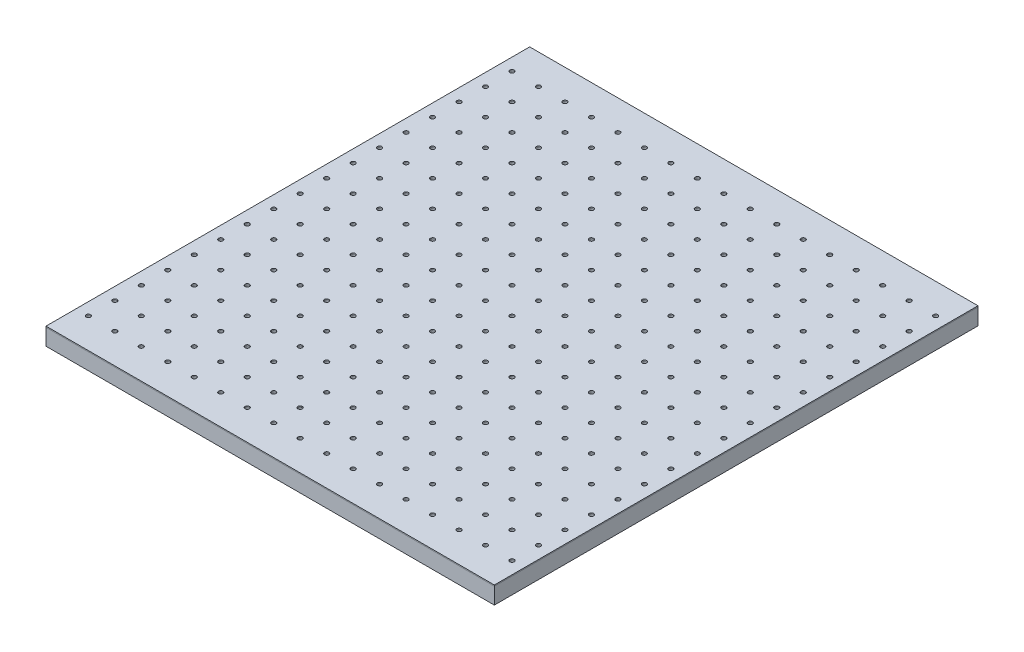
from build123d import *

# Parameters (mm, degrees)
SKETCH1_W            = 508
SKETCH1_H            = 548
BOSS_EXTRUDE1_DEPTH  = 18.5
BOSS_EXTRUDE2_START  = 18.5
SKETCH1_3_W          = 508
SKETCH1_3_H          = 548
BOSS_EXTRUDE2_DEPTH  = 1.27
SKETCH1_10_R         = 2.5
CUT_EXTRUDE3_DEPTH   = 19.77
LPATTERN1_COUNT      = 9
LPATTERN1_PITCH      = 30
LPATTERN1_COUNT_DIR2 = 9
LPATTERN1_PITCH_DIR2 = 30
MIRROR1_START        = 18
MIRROR1_OUTLINE_R    = 2.5
MIRROR1_DEPTH        = 3
MIRROR1_START_2      = -1
MIRROR1_2_OUTLINE_R  = 2.5
MIRROR1_2_DEPTH      = 20
MIRROR2_START        = 18
MIRROR2_OUTLINE_R    = 2.5
MIRROR2_DEPTH        = 3
MIRROR2_START_2      = -1
MIRROR2_2_OUTLINE_R  = 2.5
MIRROR2_2_DEPTH      = 20


with BuildPart() as part:
    # Sketch1 → Boss-Extrude1 (new body)
    with BuildSketch(Plane(origin=(0, 0, 0), x_dir=(1, 0, 0), z_dir=(0, 1, 0))):
        with Locations((-23.980732177, 60.620423892)):
            Rectangle(SKETCH1_W, SKETCH1_H)
    extrude(amount=BOSS_EXTRUDE1_DEPTH)


with BuildPart() as body_2:
    # Sketch1<3> → Boss-Extrude2 (new body)
    with BuildSketch(Plane(origin=(0, 0, 0), x_dir=(1, 0, 0), z_dir=(0, 1, 0)).offset(BOSS_EXTRUDE2_START)):
        with Locations((-23.980732177, 60.620423892)):
            Rectangle(SKETCH1_3_W, SKETCH1_3_H)
    extrude(amount=BOSS_EXTRUDE2_DEPTH)


with BuildPart() as cut_extrude3_tool:
    # Sketch1<10> → Cut-Extrude3 (new body)
    with BuildSketch(Plane(origin=(0, 0, 0), x_dir=(1, 0, 0), z_dir=(0, 1, 0))):
        with Locations(Location((-23.980732177, 60.620423892, 0), (0, 0, 90))):
            Circle(SKETCH1_10_R)
    cut_extrude3 = extrude(amount=CUT_EXTRUDE3_DEPTH)


with BuildPart() as part_1:
    add(part.part)

    # Cut-Extrude3: cut by cut_extrude3_tool
    add(cut_extrude3_tool.part, mode=Mode.SUBTRACT)


with BuildPart() as body_2_1:
    add(body_2.part)

    # Cut-Extrude3: cut by cut_extrude3_tool
    add(cut_extrude3_tool.part, mode=Mode.SUBTRACT)


with BuildPart() as lpattern1_tool:
    # LPattern1: Cut-Extrude3 9 × 9
    with Locations(*[(-i * LPATTERN1_PITCH, 0, j * LPATTERN1_PITCH_DIR2) for i in range(LPATTERN1_COUNT) for j in range(LPATTERN1_COUNT_DIR2) if (i, j) != (0, 0)]):
        add(cut_extrude3)


with BuildPart() as part_2:
    add(part_1.part)

    # LPattern1: cut by lpattern1_tool
    add(lpattern1_tool.part, mode=Mode.SUBTRACT)

    # Mirror1 2 outline → Mirror1 2 (cut)
    with BuildSketch(Plane(origin=(0, 0, 0), x_dir=(1, 0, 0), z_dir=(0, 1, 0)).offset(MIRROR1_START_2)):
        with Locations((216.019267823, -179.379576108)):
            Circle(MIRROR1_2_OUTLINE_R)
        with Locations((6.019267823, 60.620423892)):
            Circle(MIRROR1_2_OUTLINE_R)
        with Locations((6.019267823, 30.620423892)):
            Circle(MIRROR1_2_OUTLINE_R)
        with Locations((6.019267823, 0.620423892)):
            Circle(MIRROR1_2_OUTLINE_R)
        with Locations((6.019267823, -29.379576108)):
            Circle(MIRROR1_2_OUTLINE_R)
        with Locations((6.019267823, -59.379576108)):
            Circle(MIRROR1_2_OUTLINE_R)
        with Locations((6.019267823, -89.379576108)):
            Circle(MIRROR1_2_OUTLINE_R)
        with Locations((6.019267823, -119.379576108)):
            Circle(MIRROR1_2_OUTLINE_R)
        with Locations((6.019267823, -149.379576108)):
            Circle(MIRROR1_2_OUTLINE_R)
        with Locations((6.019267823, -179.379576108)):
            Circle(MIRROR1_2_OUTLINE_R)
        with Locations((36.019267823, 60.620423892)):
            Circle(MIRROR1_2_OUTLINE_R)
        with Locations((36.019267823, 30.620423892)):
            Circle(MIRROR1_2_OUTLINE_R)
        with Locations((36.019267823, 0.620423892)):
            Circle(MIRROR1_2_OUTLINE_R)
        with Locations((36.019267823, -29.379576108)):
            Circle(MIRROR1_2_OUTLINE_R)
        with Locations((36.019267823, -59.379576108)):
            Circle(MIRROR1_2_OUTLINE_R)
        with Locations((36.019267823, -89.379576108)):
            Circle(MIRROR1_2_OUTLINE_R)
        with Locations((36.019267823, -119.379576108)):
            Circle(MIRROR1_2_OUTLINE_R)
        with Locations((36.019267823, -149.379576108)):
            Circle(MIRROR1_2_OUTLINE_R)
        with Locations((36.019267823, -179.379576108)):
            Circle(MIRROR1_2_OUTLINE_R)
        with Locations((66.019267823, 60.620423892)):
            Circle(MIRROR1_2_OUTLINE_R)
        with Locations((66.019267823, 30.620423892)):
            Circle(MIRROR1_2_OUTLINE_R)
        with Locations((66.019267823, 0.620423892)):
            Circle(MIRROR1_2_OUTLINE_R)
        with Locations((66.019267823, -29.379576108)):
            Circle(MIRROR1_2_OUTLINE_R)
        with Locations((66.019267823, -59.379576108)):
            Circle(MIRROR1_2_OUTLINE_R)
        with Locations((66.019267823, -89.379576108)):
            Circle(MIRROR1_2_OUTLINE_R)
        with Locations((66.019267823, -119.379576108)):
            Circle(MIRROR1_2_OUTLINE_R)
        with Locations((66.019267823, -149.379576108)):
            Circle(MIRROR1_2_OUTLINE_R)
        with Locations((66.019267823, -179.379576108)):
            Circle(MIRROR1_2_OUTLINE_R)
        with Locations((96.019267823, 60.620423892)):
            Circle(MIRROR1_2_OUTLINE_R)
        with Locations((96.019267823, 30.620423892)):
            Circle(MIRROR1_2_OUTLINE_R)
        with Locations((96.019267823, 0.620423892)):
            Circle(MIRROR1_2_OUTLINE_R)
        with Locations((96.019267823, -29.379576108)):
            Circle(MIRROR1_2_OUTLINE_R)
        with Locations((96.019267823, -59.379576108)):
            Circle(MIRROR1_2_OUTLINE_R)
        with Locations((96.019267823, -89.379576108)):
            Circle(MIRROR1_2_OUTLINE_R)
        with Locations((96.019267823, -119.379576108)):
            Circle(MIRROR1_2_OUTLINE_R)
        with Locations((96.019267823, -149.379576108)):
            Circle(MIRROR1_2_OUTLINE_R)
        with Locations((96.019267823, -179.379576108)):
            Circle(MIRROR1_2_OUTLINE_R)
        with Locations((126.019267823, 60.620423892)):
            Circle(MIRROR1_2_OUTLINE_R)
        with Locations((126.019267823, 30.620423892)):
            Circle(MIRROR1_2_OUTLINE_R)
        with Locations((126.019267823, 0.620423892)):
            Circle(MIRROR1_2_OUTLINE_R)
        with Locations((126.019267823, -29.379576108)):
            Circle(MIRROR1_2_OUTLINE_R)
        with Locations((126.019267823, -59.379576108)):
            Circle(MIRROR1_2_OUTLINE_R)
        with Locations((126.019267823, -89.379576108)):
            Circle(MIRROR1_2_OUTLINE_R)
        with Locations((126.019267823, -119.379576108)):
            Circle(MIRROR1_2_OUTLINE_R)
        with Locations((126.019267823, -149.379576108)):
            Circle(MIRROR1_2_OUTLINE_R)
        with Locations((126.019267823, -179.379576108)):
            Circle(MIRROR1_2_OUTLINE_R)
        with Locations((156.019267823, 60.620423892)):
            Circle(MIRROR1_2_OUTLINE_R)
        with Locations((156.019267823, 30.620423892)):
            Circle(MIRROR1_2_OUTLINE_R)
        with Locations((156.019267823, 0.620423892)):
            Circle(MIRROR1_2_OUTLINE_R)
        with Locations((156.019267823, -29.379576108)):
            Circle(MIRROR1_2_OUTLINE_R)
        with Locations((156.019267823, -59.379576108)):
            Circle(MIRROR1_2_OUTLINE_R)
        with Locations((156.019267823, -89.379576108)):
            Circle(MIRROR1_2_OUTLINE_R)
        with Locations((156.019267823, -119.379576108)):
            Circle(MIRROR1_2_OUTLINE_R)
        with Locations((156.019267823, -149.379576108)):
            Circle(MIRROR1_2_OUTLINE_R)
        with Locations((156.019267823, -179.379576108)):
            Circle(MIRROR1_2_OUTLINE_R)
        with Locations((186.019267823, 60.620423892)):
            Circle(MIRROR1_2_OUTLINE_R)
        with Locations((186.019267823, 30.620423892)):
            Circle(MIRROR1_2_OUTLINE_R)
        with Locations((186.019267823, 0.620423892)):
            Circle(MIRROR1_2_OUTLINE_R)
        with Locations((186.019267823, -29.379576108)):
            Circle(MIRROR1_2_OUTLINE_R)
        with Locations((186.019267823, -59.379576108)):
            Circle(MIRROR1_2_OUTLINE_R)
        with Locations((186.019267823, -89.379576108)):
            Circle(MIRROR1_2_OUTLINE_R)
        with Locations((186.019267823, -119.379576108)):
            Circle(MIRROR1_2_OUTLINE_R)
        with Locations((186.019267823, -149.379576108)):
            Circle(MIRROR1_2_OUTLINE_R)
        with Locations((186.019267823, -179.379576108)):
            Circle(MIRROR1_2_OUTLINE_R)
        with Locations((216.019267823, 60.620423892)):
            Circle(MIRROR1_2_OUTLINE_R)
        with Locations((216.019267823, 30.620423892)):
            Circle(MIRROR1_2_OUTLINE_R)
        with Locations((216.019267823, 0.620423892)):
            Circle(MIRROR1_2_OUTLINE_R)
        with Locations((216.019267823, -29.379576108)):
            Circle(MIRROR1_2_OUTLINE_R)
        with Locations((216.019267823, -59.379576108)):
            Circle(MIRROR1_2_OUTLINE_R)
        with Locations((216.019267823, -89.379576108)):
            Circle(MIRROR1_2_OUTLINE_R)
        with Locations((216.019267823, -119.379576108)):
            Circle(MIRROR1_2_OUTLINE_R)
        with Locations((216.019267823, -149.379576108)):
            Circle(MIRROR1_2_OUTLINE_R)
    extrude(amount=MIRROR1_2_DEPTH, mode=Mode.SUBTRACT)

    # Mirror2 2 outline → Mirror2 2 (cut)
    with BuildSketch(Plane(origin=(0, 0, 0), x_dir=(1, 0, 0), z_dir=(0, 1, 0)).offset(MIRROR2_START_2)):
        with Locations((216.019267823, 270.620423892)):
            Circle(MIRROR2_2_OUTLINE_R)
        with Locations((-23.980732177, 90.620423892)):
            Circle(MIRROR2_2_OUTLINE_R)
        with Locations((-23.980732177, 120.620423892)):
            Circle(MIRROR2_2_OUTLINE_R)
        with Locations((-23.980732177, 150.620423892)):
            Circle(MIRROR2_2_OUTLINE_R)
        with Locations((-23.980732177, 180.620423892)):
            Circle(MIRROR2_2_OUTLINE_R)
        with Locations((-23.980732177, 210.620423892)):
            Circle(MIRROR2_2_OUTLINE_R)
        with Locations((-23.980732177, 240.620423892)):
            Circle(MIRROR2_2_OUTLINE_R)
        with Locations((-23.980732177, 270.620423892)):
            Circle(MIRROR2_2_OUTLINE_R)
        with Locations((-23.980732177, 300.620423892)):
            Circle(MIRROR2_2_OUTLINE_R)
        with Locations((-53.980732177, 90.620423892)):
            Circle(MIRROR2_2_OUTLINE_R)
        with Locations((-53.980732177, 120.620423892)):
            Circle(MIRROR2_2_OUTLINE_R)
        with Locations((-53.980732177, 150.620423892)):
            Circle(MIRROR2_2_OUTLINE_R)
        with Locations((-53.980732177, 180.620423892)):
            Circle(MIRROR2_2_OUTLINE_R)
        with Locations((-53.980732177, 210.620423892)):
            Circle(MIRROR2_2_OUTLINE_R)
        with Locations((-53.980732177, 240.620423892)):
            Circle(MIRROR2_2_OUTLINE_R)
        with Locations((-53.980732177, 270.620423892)):
            Circle(MIRROR2_2_OUTLINE_R)
        with Locations((-53.980732177, 300.620423892)):
            Circle(MIRROR2_2_OUTLINE_R)
        with Locations((-83.980732177, 90.620423892)):
            Circle(MIRROR2_2_OUTLINE_R)
        with Locations((-83.980732177, 120.620423892)):
            Circle(MIRROR2_2_OUTLINE_R)
        with Locations((-83.980732177, 150.620423892)):
            Circle(MIRROR2_2_OUTLINE_R)
        with Locations((-83.980732177, 180.620423892)):
            Circle(MIRROR2_2_OUTLINE_R)
        with Locations((-83.980732177, 210.620423892)):
            Circle(MIRROR2_2_OUTLINE_R)
        with Locations((-83.980732177, 240.620423892)):
            Circle(MIRROR2_2_OUTLINE_R)
        with Locations((-83.980732177, 270.620423892)):
            Circle(MIRROR2_2_OUTLINE_R)
        with Locations((-83.980732177, 300.620423892)):
            Circle(MIRROR2_2_OUTLINE_R)
        with Locations((-113.980732177, 90.620423892)):
            Circle(MIRROR2_2_OUTLINE_R)
        with Locations((-113.980732177, 120.620423892)):
            Circle(MIRROR2_2_OUTLINE_R)
        with Locations((-113.980732177, 150.620423892)):
            Circle(MIRROR2_2_OUTLINE_R)
        with Locations((-113.980732177, 180.620423892)):
            Circle(MIRROR2_2_OUTLINE_R)
        with Locations((-113.980732177, 210.620423892)):
            Circle(MIRROR2_2_OUTLINE_R)
        with Locations((-113.980732177, 240.620423892)):
            Circle(MIRROR2_2_OUTLINE_R)
        with Locations((-113.980732177, 270.620423892)):
            Circle(MIRROR2_2_OUTLINE_R)
        with Locations((-113.980732177, 300.620423892)):
            Circle(MIRROR2_2_OUTLINE_R)
        with Locations((-143.980732177, 90.620423892)):
            Circle(MIRROR2_2_OUTLINE_R)
        with Locations((-143.980732177, 120.620423892)):
            Circle(MIRROR2_2_OUTLINE_R)
        with Locations((-143.980732177, 150.620423892)):
            Circle(MIRROR2_2_OUTLINE_R)
        with Locations((-143.980732177, 180.620423892)):
            Circle(MIRROR2_2_OUTLINE_R)
        with Locations((-143.980732177, 210.620423892)):
            Circle(MIRROR2_2_OUTLINE_R)
        with Locations((-143.980732177, 240.620423892)):
            Circle(MIRROR2_2_OUTLINE_R)
        with Locations((-143.980732177, 270.620423892)):
            Circle(MIRROR2_2_OUTLINE_R)
        with Locations((-143.980732177, 300.620423892)):
            Circle(MIRROR2_2_OUTLINE_R)
        with Locations((-173.980732177, 90.620423892)):
            Circle(MIRROR2_2_OUTLINE_R)
        with Locations((-173.980732177, 120.620423892)):
            Circle(MIRROR2_2_OUTLINE_R)
        with Locations((-173.980732177, 150.620423892)):
            Circle(MIRROR2_2_OUTLINE_R)
        with Locations((-173.980732177, 180.620423892)):
            Circle(MIRROR2_2_OUTLINE_R)
        with Locations((-173.980732177, 210.620423892)):
            Circle(MIRROR2_2_OUTLINE_R)
        with Locations((-173.980732177, 240.620423892)):
            Circle(MIRROR2_2_OUTLINE_R)
        with Locations((-173.980732177, 270.620423892)):
            Circle(MIRROR2_2_OUTLINE_R)
        with Locations((-173.980732177, 300.620423892)):
            Circle(MIRROR2_2_OUTLINE_R)
        with Locations((-203.980732177, 90.620423892)):
            Circle(MIRROR2_2_OUTLINE_R)
        with Locations((-203.980732177, 120.620423892)):
            Circle(MIRROR2_2_OUTLINE_R)
        with Locations((-203.980732177, 150.620423892)):
            Circle(MIRROR2_2_OUTLINE_R)
        with Locations((-203.980732177, 180.620423892)):
            Circle(MIRROR2_2_OUTLINE_R)
        with Locations((-203.980732177, 210.620423892)):
            Circle(MIRROR2_2_OUTLINE_R)
        with Locations((-203.980732177, 240.620423892)):
            Circle(MIRROR2_2_OUTLINE_R)
        with Locations((-203.980732177, 270.620423892)):
            Circle(MIRROR2_2_OUTLINE_R)
        with Locations((-203.980732177, 300.620423892)):
            Circle(MIRROR2_2_OUTLINE_R)
        with Locations((-233.980732177, 90.620423892)):
            Circle(MIRROR2_2_OUTLINE_R)
        with Locations((-233.980732177, 120.620423892)):
            Circle(MIRROR2_2_OUTLINE_R)
        with Locations((-233.980732177, 150.620423892)):
            Circle(MIRROR2_2_OUTLINE_R)
        with Locations((-233.980732177, 180.620423892)):
            Circle(MIRROR2_2_OUTLINE_R)
        with Locations((-233.980732177, 210.620423892)):
            Circle(MIRROR2_2_OUTLINE_R)
        with Locations((-233.980732177, 240.620423892)):
            Circle(MIRROR2_2_OUTLINE_R)
        with Locations((-233.980732177, 270.620423892)):
            Circle(MIRROR2_2_OUTLINE_R)
        with Locations((-233.980732177, 300.620423892)):
            Circle(MIRROR2_2_OUTLINE_R)
        with Locations((-263.980732177, 90.620423892)):
            Circle(MIRROR2_2_OUTLINE_R)
        with Locations((-263.980732177, 120.620423892)):
            Circle(MIRROR2_2_OUTLINE_R)
        with Locations((-263.980732177, 150.620423892)):
            Circle(MIRROR2_2_OUTLINE_R)
        with Locations((-263.980732177, 180.620423892)):
            Circle(MIRROR2_2_OUTLINE_R)
        with Locations((-263.980732177, 210.620423892)):
            Circle(MIRROR2_2_OUTLINE_R)
        with Locations((-263.980732177, 240.620423892)):
            Circle(MIRROR2_2_OUTLINE_R)
        with Locations((-263.980732177, 270.620423892)):
            Circle(MIRROR2_2_OUTLINE_R)
        with Locations((-263.980732177, 300.620423892)):
            Circle(MIRROR2_2_OUTLINE_R)
        with Locations((216.019267823, 300.620423892)):
            Circle(MIRROR2_2_OUTLINE_R)
        with Locations((6.019267823, 90.620423892)):
            Circle(MIRROR2_2_OUTLINE_R)
        with Locations((6.019267823, 120.620423892)):
            Circle(MIRROR2_2_OUTLINE_R)
        with Locations((6.019267823, 150.620423892)):
            Circle(MIRROR2_2_OUTLINE_R)
        with Locations((6.019267823, 180.620423892)):
            Circle(MIRROR2_2_OUTLINE_R)
        with Locations((6.019267823, 210.620423892)):
            Circle(MIRROR2_2_OUTLINE_R)
        with Locations((6.019267823, 240.620423892)):
            Circle(MIRROR2_2_OUTLINE_R)
        with Locations((6.019267823, 270.620423892)):
            Circle(MIRROR2_2_OUTLINE_R)
        with Locations((6.019267823, 300.620423892)):
            Circle(MIRROR2_2_OUTLINE_R)
        with Locations((36.019267823, 90.620423892)):
            Circle(MIRROR2_2_OUTLINE_R)
        with Locations((36.019267823, 120.620423892)):
            Circle(MIRROR2_2_OUTLINE_R)
        with Locations((36.019267823, 150.620423892)):
            Circle(MIRROR2_2_OUTLINE_R)
        with Locations((36.019267823, 180.620423892)):
            Circle(MIRROR2_2_OUTLINE_R)
        with Locations((36.019267823, 210.620423892)):
            Circle(MIRROR2_2_OUTLINE_R)
        with Locations((36.019267823, 240.620423892)):
            Circle(MIRROR2_2_OUTLINE_R)
        with Locations((36.019267823, 270.620423892)):
            Circle(MIRROR2_2_OUTLINE_R)
        with Locations((36.019267823, 300.620423892)):
            Circle(MIRROR2_2_OUTLINE_R)
        with Locations((66.019267823, 90.620423892)):
            Circle(MIRROR2_2_OUTLINE_R)
        with Locations((66.019267823, 120.620423892)):
            Circle(MIRROR2_2_OUTLINE_R)
        with Locations((66.019267823, 150.620423892)):
            Circle(MIRROR2_2_OUTLINE_R)
        with Locations((66.019267823, 180.620423892)):
            Circle(MIRROR2_2_OUTLINE_R)
        with Locations((66.019267823, 210.620423892)):
            Circle(MIRROR2_2_OUTLINE_R)
        with Locations((66.019267823, 240.620423892)):
            Circle(MIRROR2_2_OUTLINE_R)
        with Locations((66.019267823, 270.620423892)):
            Circle(MIRROR2_2_OUTLINE_R)
        with Locations((66.019267823, 300.620423892)):
            Circle(MIRROR2_2_OUTLINE_R)
        with Locations((96.019267823, 90.620423892)):
            Circle(MIRROR2_2_OUTLINE_R)
        with Locations((96.019267823, 120.620423892)):
            Circle(MIRROR2_2_OUTLINE_R)
        with Locations((96.019267823, 150.620423892)):
            Circle(MIRROR2_2_OUTLINE_R)
        with Locations((96.019267823, 180.620423892)):
            Circle(MIRROR2_2_OUTLINE_R)
        with Locations((96.019267823, 210.620423892)):
            Circle(MIRROR2_2_OUTLINE_R)
        with Locations((96.019267823, 240.620423892)):
            Circle(MIRROR2_2_OUTLINE_R)
        with Locations((96.019267823, 270.620423892)):
            Circle(MIRROR2_2_OUTLINE_R)
        with Locations((96.019267823, 300.620423892)):
            Circle(MIRROR2_2_OUTLINE_R)
        with Locations((126.019267823, 90.620423892)):
            Circle(MIRROR2_2_OUTLINE_R)
        with Locations((126.019267823, 120.620423892)):
            Circle(MIRROR2_2_OUTLINE_R)
        with Locations((126.019267823, 150.620423892)):
            Circle(MIRROR2_2_OUTLINE_R)
        with Locations((126.019267823, 180.620423892)):
            Circle(MIRROR2_2_OUTLINE_R)
        with Locations((126.019267823, 210.620423892)):
            Circle(MIRROR2_2_OUTLINE_R)
        with Locations((126.019267823, 240.620423892)):
            Circle(MIRROR2_2_OUTLINE_R)
        with Locations((126.019267823, 270.620423892)):
            Circle(MIRROR2_2_OUTLINE_R)
        with Locations((126.019267823, 300.620423892)):
            Circle(MIRROR2_2_OUTLINE_R)
        with Locations((156.019267823, 90.620423892)):
            Circle(MIRROR2_2_OUTLINE_R)
        with Locations((156.019267823, 120.620423892)):
            Circle(MIRROR2_2_OUTLINE_R)
        with Locations((156.019267823, 150.620423892)):
            Circle(MIRROR2_2_OUTLINE_R)
        with Locations((156.019267823, 180.620423892)):
            Circle(MIRROR2_2_OUTLINE_R)
        with Locations((156.019267823, 210.620423892)):
            Circle(MIRROR2_2_OUTLINE_R)
        with Locations((156.019267823, 240.620423892)):
            Circle(MIRROR2_2_OUTLINE_R)
        with Locations((156.019267823, 270.620423892)):
            Circle(MIRROR2_2_OUTLINE_R)
        with Locations((156.019267823, 300.620423892)):
            Circle(MIRROR2_2_OUTLINE_R)
        with Locations((186.019267823, 90.620423892)):
            Circle(MIRROR2_2_OUTLINE_R)
        with Locations((186.019267823, 120.620423892)):
            Circle(MIRROR2_2_OUTLINE_R)
        with Locations((186.019267823, 150.620423892)):
            Circle(MIRROR2_2_OUTLINE_R)
        with Locations((186.019267823, 180.620423892)):
            Circle(MIRROR2_2_OUTLINE_R)
        with Locations((186.019267823, 210.620423892)):
            Circle(MIRROR2_2_OUTLINE_R)
        with Locations((186.019267823, 240.620423892)):
            Circle(MIRROR2_2_OUTLINE_R)
        with Locations((186.019267823, 270.620423892)):
            Circle(MIRROR2_2_OUTLINE_R)
        with Locations((186.019267823, 300.620423892)):
            Circle(MIRROR2_2_OUTLINE_R)
        with Locations((216.019267823, 90.620423892)):
            Circle(MIRROR2_2_OUTLINE_R)
        with Locations((216.019267823, 120.620423892)):
            Circle(MIRROR2_2_OUTLINE_R)
        with Locations((216.019267823, 150.620423892)):
            Circle(MIRROR2_2_OUTLINE_R)
        with Locations((216.019267823, 180.620423892)):
            Circle(MIRROR2_2_OUTLINE_R)
        with Locations((216.019267823, 210.620423892)):
            Circle(MIRROR2_2_OUTLINE_R)
        with Locations((216.019267823, 240.620423892)):
            Circle(MIRROR2_2_OUTLINE_R)
    extrude(amount=MIRROR2_2_DEPTH, mode=Mode.SUBTRACT)


with BuildPart() as body_2_2:
    add(body_2_1.part)

    # LPattern1: cut by lpattern1_tool
    add(lpattern1_tool.part, mode=Mode.SUBTRACT)

    # Mirror1: read off the stored shape, not the designer's step
    # Mirror1 outline → Mirror1 (cut)
    with BuildSketch(Plane(origin=(0, 0, 0), x_dir=(1, 0, 0), z_dir=(0, 1, 0)).offset(MIRROR1_START)):
        with Locations((216.019267823, -179.379576108)):
            Circle(MIRROR1_OUTLINE_R)
        with Locations((6.019267823, 60.620423892)):
            Circle(MIRROR1_OUTLINE_R)
        with Locations((6.019267823, 30.620423892)):
            Circle(MIRROR1_OUTLINE_R)
        with Locations((6.019267823, 0.620423892)):
            Circle(MIRROR1_OUTLINE_R)
        with Locations((6.019267823, -29.379576108)):
            Circle(MIRROR1_OUTLINE_R)
        with Locations((6.019267823, -59.379576108)):
            Circle(MIRROR1_OUTLINE_R)
        with Locations((6.019267823, -89.379576108)):
            Circle(MIRROR1_OUTLINE_R)
        with Locations((6.019267823, -119.379576108)):
            Circle(MIRROR1_OUTLINE_R)
        with Locations((6.019267823, -149.379576108)):
            Circle(MIRROR1_OUTLINE_R)
        with Locations((6.019267823, -179.379576108)):
            Circle(MIRROR1_OUTLINE_R)
        with Locations((36.019267823, 60.620423892)):
            Circle(MIRROR1_OUTLINE_R)
        with Locations((36.019267823, 30.620423892)):
            Circle(MIRROR1_OUTLINE_R)
        with Locations((36.019267823, 0.620423892)):
            Circle(MIRROR1_OUTLINE_R)
        with Locations((36.019267823, -29.379576108)):
            Circle(MIRROR1_OUTLINE_R)
        with Locations((36.019267823, -59.379576108)):
            Circle(MIRROR1_OUTLINE_R)
        with Locations((36.019267823, -89.379576108)):
            Circle(MIRROR1_OUTLINE_R)
        with Locations((36.019267823, -119.379576108)):
            Circle(MIRROR1_OUTLINE_R)
        with Locations((36.019267823, -149.379576108)):
            Circle(MIRROR1_OUTLINE_R)
        with Locations((36.019267823, -179.379576108)):
            Circle(MIRROR1_OUTLINE_R)
        with Locations((66.019267823, 60.620423892)):
            Circle(MIRROR1_OUTLINE_R)
        with Locations((66.019267823, 30.620423892)):
            Circle(MIRROR1_OUTLINE_R)
        with Locations((66.019267823, 0.620423892)):
            Circle(MIRROR1_OUTLINE_R)
        with Locations((66.019267823, -29.379576108)):
            Circle(MIRROR1_OUTLINE_R)
        with Locations((66.019267823, -59.379576108)):
            Circle(MIRROR1_OUTLINE_R)
        with Locations((66.019267823, -89.379576108)):
            Circle(MIRROR1_OUTLINE_R)
        with Locations((66.019267823, -119.379576108)):
            Circle(MIRROR1_OUTLINE_R)
        with Locations((66.019267823, -149.379576108)):
            Circle(MIRROR1_OUTLINE_R)
        with Locations((66.019267823, -179.379576108)):
            Circle(MIRROR1_OUTLINE_R)
        with Locations((96.019267823, 60.620423892)):
            Circle(MIRROR1_OUTLINE_R)
        with Locations((96.019267823, 30.620423892)):
            Circle(MIRROR1_OUTLINE_R)
        with Locations((96.019267823, 0.620423892)):
            Circle(MIRROR1_OUTLINE_R)
        with Locations((96.019267823, -29.379576108)):
            Circle(MIRROR1_OUTLINE_R)
        with Locations((96.019267823, -59.379576108)):
            Circle(MIRROR1_OUTLINE_R)
        with Locations((96.019267823, -89.379576108)):
            Circle(MIRROR1_OUTLINE_R)
        with Locations((96.019267823, -119.379576108)):
            Circle(MIRROR1_OUTLINE_R)
        with Locations((96.019267823, -149.379576108)):
            Circle(MIRROR1_OUTLINE_R)
        with Locations((96.019267823, -179.379576108)):
            Circle(MIRROR1_OUTLINE_R)
        with Locations((126.019267823, 60.620423892)):
            Circle(MIRROR1_OUTLINE_R)
        with Locations((126.019267823, 30.620423892)):
            Circle(MIRROR1_OUTLINE_R)
        with Locations((126.019267823, 0.620423892)):
            Circle(MIRROR1_OUTLINE_R)
        with Locations((126.019267823, -29.379576108)):
            Circle(MIRROR1_OUTLINE_R)
        with Locations((126.019267823, -59.379576108)):
            Circle(MIRROR1_OUTLINE_R)
        with Locations((126.019267823, -89.379576108)):
            Circle(MIRROR1_OUTLINE_R)
        with Locations((126.019267823, -119.379576108)):
            Circle(MIRROR1_OUTLINE_R)
        with Locations((126.019267823, -149.379576108)):
            Circle(MIRROR1_OUTLINE_R)
        with Locations((126.019267823, -179.379576108)):
            Circle(MIRROR1_OUTLINE_R)
        with Locations((156.019267823, 60.620423892)):
            Circle(MIRROR1_OUTLINE_R)
        with Locations((156.019267823, 30.620423892)):
            Circle(MIRROR1_OUTLINE_R)
        with Locations((156.019267823, 0.620423892)):
            Circle(MIRROR1_OUTLINE_R)
        with Locations((156.019267823, -29.379576108)):
            Circle(MIRROR1_OUTLINE_R)
        with Locations((156.019267823, -59.379576108)):
            Circle(MIRROR1_OUTLINE_R)
        with Locations((156.019267823, -89.379576108)):
            Circle(MIRROR1_OUTLINE_R)
        with Locations((156.019267823, -119.379576108)):
            Circle(MIRROR1_OUTLINE_R)
        with Locations((156.019267823, -149.379576108)):
            Circle(MIRROR1_OUTLINE_R)
        with Locations((156.019267823, -179.379576108)):
            Circle(MIRROR1_OUTLINE_R)
        with Locations((186.019267823, 60.620423892)):
            Circle(MIRROR1_OUTLINE_R)
        with Locations((186.019267823, 30.620423892)):
            Circle(MIRROR1_OUTLINE_R)
        with Locations((186.019267823, 0.620423892)):
            Circle(MIRROR1_OUTLINE_R)
        with Locations((186.019267823, -29.379576108)):
            Circle(MIRROR1_OUTLINE_R)
        with Locations((186.019267823, -59.379576108)):
            Circle(MIRROR1_OUTLINE_R)
        with Locations((186.019267823, -89.379576108)):
            Circle(MIRROR1_OUTLINE_R)
        with Locations((186.019267823, -119.379576108)):
            Circle(MIRROR1_OUTLINE_R)
        with Locations((186.019267823, -149.379576108)):
            Circle(MIRROR1_OUTLINE_R)
        with Locations((186.019267823, -179.379576108)):
            Circle(MIRROR1_OUTLINE_R)
        with Locations((216.019267823, 60.620423892)):
            Circle(MIRROR1_OUTLINE_R)
        with Locations((216.019267823, 30.620423892)):
            Circle(MIRROR1_OUTLINE_R)
        with Locations((216.019267823, 0.620423892)):
            Circle(MIRROR1_OUTLINE_R)
        with Locations((216.019267823, -29.379576108)):
            Circle(MIRROR1_OUTLINE_R)
        with Locations((216.019267823, -59.379576108)):
            Circle(MIRROR1_OUTLINE_R)
        with Locations((216.019267823, -89.379576108)):
            Circle(MIRROR1_OUTLINE_R)
        with Locations((216.019267823, -119.379576108)):
            Circle(MIRROR1_OUTLINE_R)
        with Locations((216.019267823, -149.379576108)):
            Circle(MIRROR1_OUTLINE_R)
    extrude(amount=MIRROR1_DEPTH, mode=Mode.SUBTRACT)

    # Mirror2: read off the stored shape, not the designer's step
    # Mirror2 outline → Mirror2 (cut)
    with BuildSketch(Plane(origin=(0, 0, 0), x_dir=(1, 0, 0), z_dir=(0, 1, 0)).offset(MIRROR2_START)):
        with Locations((216.019267823, 270.620423892)):
            Circle(MIRROR2_OUTLINE_R)
        with Locations((-23.980732177, 90.620423892)):
            Circle(MIRROR2_OUTLINE_R)
        with Locations((-23.980732177, 120.620423892)):
            Circle(MIRROR2_OUTLINE_R)
        with Locations((-23.980732177, 150.620423892)):
            Circle(MIRROR2_OUTLINE_R)
        with Locations((-23.980732177, 180.620423892)):
            Circle(MIRROR2_OUTLINE_R)
        with Locations((-23.980732177, 210.620423892)):
            Circle(MIRROR2_OUTLINE_R)
        with Locations((-23.980732177, 240.620423892)):
            Circle(MIRROR2_OUTLINE_R)
        with Locations((-23.980732177, 270.620423892)):
            Circle(MIRROR2_OUTLINE_R)
        with Locations((-23.980732177, 300.620423892)):
            Circle(MIRROR2_OUTLINE_R)
        with Locations((-53.980732177, 90.620423892)):
            Circle(MIRROR2_OUTLINE_R)
        with Locations((-53.980732177, 120.620423892)):
            Circle(MIRROR2_OUTLINE_R)
        with Locations((-53.980732177, 150.620423892)):
            Circle(MIRROR2_OUTLINE_R)
        with Locations((-53.980732177, 180.620423892)):
            Circle(MIRROR2_OUTLINE_R)
        with Locations((-53.980732177, 210.620423892)):
            Circle(MIRROR2_OUTLINE_R)
        with Locations((-53.980732177, 240.620423892)):
            Circle(MIRROR2_OUTLINE_R)
        with Locations((-53.980732177, 270.620423892)):
            Circle(MIRROR2_OUTLINE_R)
        with Locations((-53.980732177, 300.620423892)):
            Circle(MIRROR2_OUTLINE_R)
        with Locations((-83.980732177, 90.620423892)):
            Circle(MIRROR2_OUTLINE_R)
        with Locations((-83.980732177, 120.620423892)):
            Circle(MIRROR2_OUTLINE_R)
        with Locations((-83.980732177, 150.620423892)):
            Circle(MIRROR2_OUTLINE_R)
        with Locations((-83.980732177, 180.620423892)):
            Circle(MIRROR2_OUTLINE_R)
        with Locations((-83.980732177, 210.620423892)):
            Circle(MIRROR2_OUTLINE_R)
        with Locations((-83.980732177, 240.620423892)):
            Circle(MIRROR2_OUTLINE_R)
        with Locations((-83.980732177, 270.620423892)):
            Circle(MIRROR2_OUTLINE_R)
        with Locations((-83.980732177, 300.620423892)):
            Circle(MIRROR2_OUTLINE_R)
        with Locations((-113.980732177, 90.620423892)):
            Circle(MIRROR2_OUTLINE_R)
        with Locations((-113.980732177, 120.620423892)):
            Circle(MIRROR2_OUTLINE_R)
        with Locations((-113.980732177, 150.620423892)):
            Circle(MIRROR2_OUTLINE_R)
        with Locations((-113.980732177, 180.620423892)):
            Circle(MIRROR2_OUTLINE_R)
        with Locations((-113.980732177, 210.620423892)):
            Circle(MIRROR2_OUTLINE_R)
        with Locations((-113.980732177, 240.620423892)):
            Circle(MIRROR2_OUTLINE_R)
        with Locations((-113.980732177, 270.620423892)):
            Circle(MIRROR2_OUTLINE_R)
        with Locations((-113.980732177, 300.620423892)):
            Circle(MIRROR2_OUTLINE_R)
        with Locations((-143.980732177, 90.620423892)):
            Circle(MIRROR2_OUTLINE_R)
        with Locations((-143.980732177, 120.620423892)):
            Circle(MIRROR2_OUTLINE_R)
        with Locations((-143.980732177, 150.620423892)):
            Circle(MIRROR2_OUTLINE_R)
        with Locations((-143.980732177, 180.620423892)):
            Circle(MIRROR2_OUTLINE_R)
        with Locations((-143.980732177, 210.620423892)):
            Circle(MIRROR2_OUTLINE_R)
        with Locations((-143.980732177, 240.620423892)):
            Circle(MIRROR2_OUTLINE_R)
        with Locations((-143.980732177, 270.620423892)):
            Circle(MIRROR2_OUTLINE_R)
        with Locations((-143.980732177, 300.620423892)):
            Circle(MIRROR2_OUTLINE_R)
        with Locations((-173.980732177, 90.620423892)):
            Circle(MIRROR2_OUTLINE_R)
        with Locations((-173.980732177, 120.620423892)):
            Circle(MIRROR2_OUTLINE_R)
        with Locations((-173.980732177, 150.620423892)):
            Circle(MIRROR2_OUTLINE_R)
        with Locations((-173.980732177, 180.620423892)):
            Circle(MIRROR2_OUTLINE_R)
        with Locations((-173.980732177, 210.620423892)):
            Circle(MIRROR2_OUTLINE_R)
        with Locations((-173.980732177, 240.620423892)):
            Circle(MIRROR2_OUTLINE_R)
        with Locations((-173.980732177, 270.620423892)):
            Circle(MIRROR2_OUTLINE_R)
        with Locations((-173.980732177, 300.620423892)):
            Circle(MIRROR2_OUTLINE_R)
        with Locations((-203.980732177, 90.620423892)):
            Circle(MIRROR2_OUTLINE_R)
        with Locations((-203.980732177, 120.620423892)):
            Circle(MIRROR2_OUTLINE_R)
        with Locations((-203.980732177, 150.620423892)):
            Circle(MIRROR2_OUTLINE_R)
        with Locations((-203.980732177, 180.620423892)):
            Circle(MIRROR2_OUTLINE_R)
        with Locations((-203.980732177, 210.620423892)):
            Circle(MIRROR2_OUTLINE_R)
        with Locations((-203.980732177, 240.620423892)):
            Circle(MIRROR2_OUTLINE_R)
        with Locations((-203.980732177, 270.620423892)):
            Circle(MIRROR2_OUTLINE_R)
        with Locations((-203.980732177, 300.620423892)):
            Circle(MIRROR2_OUTLINE_R)
        with Locations((-233.980732177, 90.620423892)):
            Circle(MIRROR2_OUTLINE_R)
        with Locations((-233.980732177, 120.620423892)):
            Circle(MIRROR2_OUTLINE_R)
        with Locations((-233.980732177, 150.620423892)):
            Circle(MIRROR2_OUTLINE_R)
        with Locations((-233.980732177, 180.620423892)):
            Circle(MIRROR2_OUTLINE_R)
        with Locations((-233.980732177, 210.620423892)):
            Circle(MIRROR2_OUTLINE_R)
        with Locations((-233.980732177, 240.620423892)):
            Circle(MIRROR2_OUTLINE_R)
        with Locations((-233.980732177, 270.620423892)):
            Circle(MIRROR2_OUTLINE_R)
        with Locations((-233.980732177, 300.620423892)):
            Circle(MIRROR2_OUTLINE_R)
        with Locations((-263.980732177, 90.620423892)):
            Circle(MIRROR2_OUTLINE_R)
        with Locations((-263.980732177, 120.620423892)):
            Circle(MIRROR2_OUTLINE_R)
        with Locations((-263.980732177, 150.620423892)):
            Circle(MIRROR2_OUTLINE_R)
        with Locations((-263.980732177, 180.620423892)):
            Circle(MIRROR2_OUTLINE_R)
        with Locations((-263.980732177, 210.620423892)):
            Circle(MIRROR2_OUTLINE_R)
        with Locations((-263.980732177, 240.620423892)):
            Circle(MIRROR2_OUTLINE_R)
        with Locations((-263.980732177, 270.620423892)):
            Circle(MIRROR2_OUTLINE_R)
        with Locations((-263.980732177, 300.620423892)):
            Circle(MIRROR2_OUTLINE_R)
        with Locations((216.019267823, 300.620423892)):
            Circle(MIRROR2_OUTLINE_R)
        with Locations((6.019267823, 90.620423892)):
            Circle(MIRROR2_OUTLINE_R)
        with Locations((6.019267823, 120.620423892)):
            Circle(MIRROR2_OUTLINE_R)
        with Locations((6.019267823, 150.620423892)):
            Circle(MIRROR2_OUTLINE_R)
        with Locations((6.019267823, 180.620423892)):
            Circle(MIRROR2_OUTLINE_R)
        with Locations((6.019267823, 210.620423892)):
            Circle(MIRROR2_OUTLINE_R)
        with Locations((6.019267823, 240.620423892)):
            Circle(MIRROR2_OUTLINE_R)
        with Locations((6.019267823, 270.620423892)):
            Circle(MIRROR2_OUTLINE_R)
        with Locations((6.019267823, 300.620423892)):
            Circle(MIRROR2_OUTLINE_R)
        with Locations((36.019267823, 90.620423892)):
            Circle(MIRROR2_OUTLINE_R)
        with Locations((36.019267823, 120.620423892)):
            Circle(MIRROR2_OUTLINE_R)
        with Locations((36.019267823, 150.620423892)):
            Circle(MIRROR2_OUTLINE_R)
        with Locations((36.019267823, 180.620423892)):
            Circle(MIRROR2_OUTLINE_R)
        with Locations((36.019267823, 210.620423892)):
            Circle(MIRROR2_OUTLINE_R)
        with Locations((36.019267823, 240.620423892)):
            Circle(MIRROR2_OUTLINE_R)
        with Locations((36.019267823, 270.620423892)):
            Circle(MIRROR2_OUTLINE_R)
        with Locations((36.019267823, 300.620423892)):
            Circle(MIRROR2_OUTLINE_R)
        with Locations((66.019267823, 90.620423892)):
            Circle(MIRROR2_OUTLINE_R)
        with Locations((66.019267823, 120.620423892)):
            Circle(MIRROR2_OUTLINE_R)
        with Locations((66.019267823, 150.620423892)):
            Circle(MIRROR2_OUTLINE_R)
        with Locations((66.019267823, 180.620423892)):
            Circle(MIRROR2_OUTLINE_R)
        with Locations((66.019267823, 210.620423892)):
            Circle(MIRROR2_OUTLINE_R)
        with Locations((66.019267823, 240.620423892)):
            Circle(MIRROR2_OUTLINE_R)
        with Locations((66.019267823, 270.620423892)):
            Circle(MIRROR2_OUTLINE_R)
        with Locations((66.019267823, 300.620423892)):
            Circle(MIRROR2_OUTLINE_R)
        with Locations((96.019267823, 90.620423892)):
            Circle(MIRROR2_OUTLINE_R)
        with Locations((96.019267823, 120.620423892)):
            Circle(MIRROR2_OUTLINE_R)
        with Locations((96.019267823, 150.620423892)):
            Circle(MIRROR2_OUTLINE_R)
        with Locations((96.019267823, 180.620423892)):
            Circle(MIRROR2_OUTLINE_R)
        with Locations((96.019267823, 210.620423892)):
            Circle(MIRROR2_OUTLINE_R)
        with Locations((96.019267823, 240.620423892)):
            Circle(MIRROR2_OUTLINE_R)
        with Locations((96.019267823, 270.620423892)):
            Circle(MIRROR2_OUTLINE_R)
        with Locations((96.019267823, 300.620423892)):
            Circle(MIRROR2_OUTLINE_R)
        with Locations((126.019267823, 90.620423892)):
            Circle(MIRROR2_OUTLINE_R)
        with Locations((126.019267823, 120.620423892)):
            Circle(MIRROR2_OUTLINE_R)
        with Locations((126.019267823, 150.620423892)):
            Circle(MIRROR2_OUTLINE_R)
        with Locations((126.019267823, 180.620423892)):
            Circle(MIRROR2_OUTLINE_R)
        with Locations((126.019267823, 210.620423892)):
            Circle(MIRROR2_OUTLINE_R)
        with Locations((126.019267823, 240.620423892)):
            Circle(MIRROR2_OUTLINE_R)
        with Locations((126.019267823, 270.620423892)):
            Circle(MIRROR2_OUTLINE_R)
        with Locations((126.019267823, 300.620423892)):
            Circle(MIRROR2_OUTLINE_R)
        with Locations((156.019267823, 90.620423892)):
            Circle(MIRROR2_OUTLINE_R)
        with Locations((156.019267823, 120.620423892)):
            Circle(MIRROR2_OUTLINE_R)
        with Locations((156.019267823, 150.620423892)):
            Circle(MIRROR2_OUTLINE_R)
        with Locations((156.019267823, 180.620423892)):
            Circle(MIRROR2_OUTLINE_R)
        with Locations((156.019267823, 210.620423892)):
            Circle(MIRROR2_OUTLINE_R)
        with Locations((156.019267823, 240.620423892)):
            Circle(MIRROR2_OUTLINE_R)
        with Locations((156.019267823, 270.620423892)):
            Circle(MIRROR2_OUTLINE_R)
        with Locations((156.019267823, 300.620423892)):
            Circle(MIRROR2_OUTLINE_R)
        with Locations((186.019267823, 90.620423892)):
            Circle(MIRROR2_OUTLINE_R)
        with Locations((186.019267823, 120.620423892)):
            Circle(MIRROR2_OUTLINE_R)
        with Locations((186.019267823, 150.620423892)):
            Circle(MIRROR2_OUTLINE_R)
        with Locations((186.019267823, 180.620423892)):
            Circle(MIRROR2_OUTLINE_R)
        with Locations((186.019267823, 210.620423892)):
            Circle(MIRROR2_OUTLINE_R)
        with Locations((186.019267823, 240.620423892)):
            Circle(MIRROR2_OUTLINE_R)
        with Locations((186.019267823, 270.620423892)):
            Circle(MIRROR2_OUTLINE_R)
        with Locations((186.019267823, 300.620423892)):
            Circle(MIRROR2_OUTLINE_R)
        with Locations((216.019267823, 90.620423892)):
            Circle(MIRROR2_OUTLINE_R)
        with Locations((216.019267823, 120.620423892)):
            Circle(MIRROR2_OUTLINE_R)
        with Locations((216.019267823, 150.620423892)):
            Circle(MIRROR2_OUTLINE_R)
        with Locations((216.019267823, 180.620423892)):
            Circle(MIRROR2_OUTLINE_R)
        with Locations((216.019267823, 210.620423892)):
            Circle(MIRROR2_OUTLINE_R)
        with Locations((216.019267823, 240.620423892)):
            Circle(MIRROR2_OUTLINE_R)
    extrude(amount=MIRROR2_DEPTH, mode=Mode.SUBTRACT)


solid = Compound([part_2.part, body_2_2.part])
